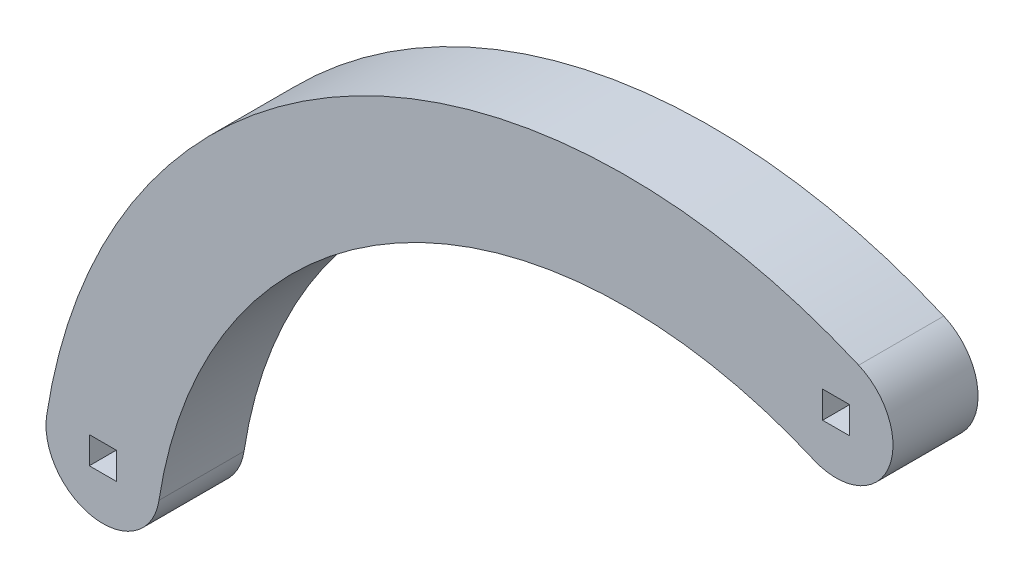
from build123d import *

# Parameters (mm, degrees)
SKETCH1_W           = 3.175
SKETCH1_H           = 3.175
BOSS_EXTRUDE1_DEPTH = 10


with BuildPart() as part:
    # Sketch1 → Boss-Extrude1 (new body)
    with BuildSketch(Plane.XY):
        with BuildLine():
            ThreePointArc((88.839713409, 53.863080545), (28.138733382, 50.876661232), (-6.602159225, 1.010860753))
            ThreePointArc((-6.602159225, 1.010860753), (-1.010860753, -6.602159225), (6.602159225, -1.010860753))
            ThreePointArc((6.602159225, -1.010860753), (34.610037038, 39.190617738), (83.546765606, 41.598249233))
            ThreePointArc((83.546765606, 41.598249233), (92.325655164, 45.084190987), (88.839713409, 53.863080545))
        make_face()
        Rectangle(SKETCH1_W, SKETCH1_H, mode=Mode.SUBTRACT)
        with Locations((86.193239508, 47.730664889)):
            Rectangle(SKETCH1_W, SKETCH1_H, mode=Mode.SUBTRACT)
    extrude(amount=BOSS_EXTRUDE1_DEPTH)


solid = part.part
